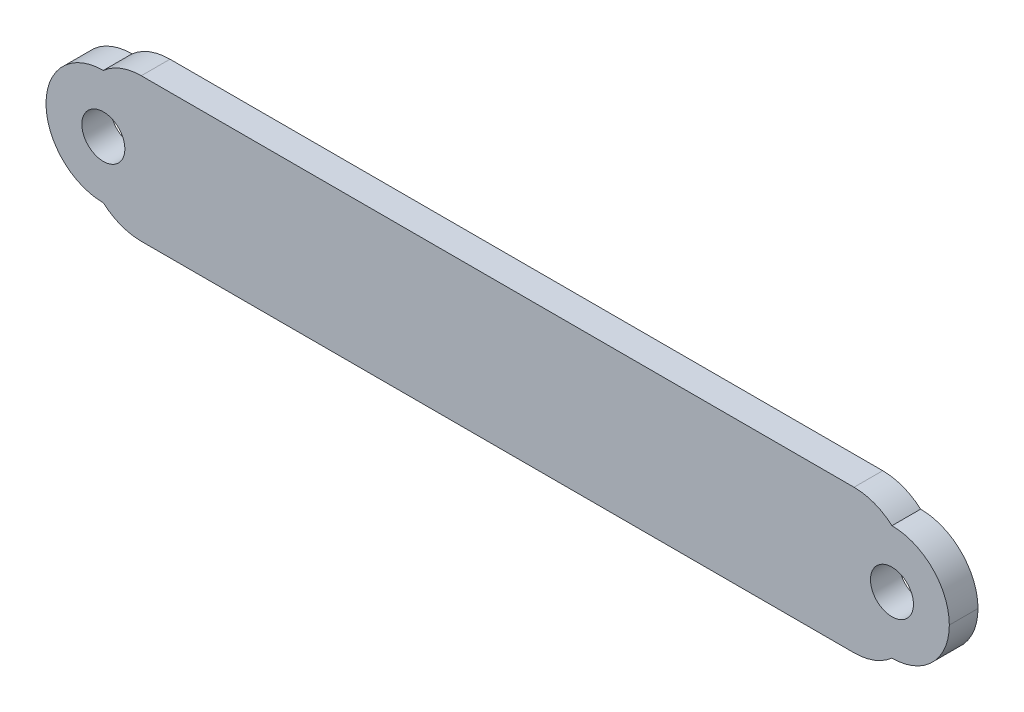
from build123d import *

# Parameters (mm, degrees)
SKETCH1_R           = 1.905
BOSS_EXTRUDE1_DEPTH = 2.54
FILLET7_R           = 5.08


with BuildPart() as part:
    # Sketch1 → Boss-Extrude1 (new body)
    with BuildSketch(Plane.XY):
        Polygon((5.08, 10.16), (6.35, 11.43), (40.005, 11.43), (40.005, -1.27), (6.35, -1.27), (5.08, 0), (0, 0), (0, 10.16), align=None)
        with Locations((5.08, 5.08)):
            Circle(SKETCH1_R, mode=Mode.SUBTRACT)
    extrude(amount=BOSS_EXTRUDE1_DEPTH)

    # Fillet7
    # the kernel refuses this fillet: 5.08 mm, written as the material it takes off along each edge
    with BuildSketch(Plane(origin=(6.35, -1.27, -5.225260413), x_dir=(1, 0, 0), z_dir=(0, 0, 1))) as fillet7_piece_1:
        with BuildLine():
            CenterArc((2.090104165, 5.08), FILLET7_R, 228.590377891, 41.409622109)
            Line((-1.27, 1.27), (-1.337202083, 1.1938))
            ThreePointArc((-1.337202083, 1.1938), (-0.706842049, 0.563157951), (-0.071842049, -0.071842049))
            Line((-0.071842049, -0.071842049), (0, -0.1016))
            Line((0, -0.1016), (2.090104165, -0.1016))
            Line((2.090104165, -0.1016), (2.090104165, 0))
        make_face()
    extrude(amount=12.990520825, mode=Mode.SUBTRACT)
    with BuildSketch(Plane(origin=(6.35, 11.43, -5.225260413), x_dir=(-0.7071067811865464, -0.7071067811865488, 0), z_dir=(0, 0, 1))) as fillet7_piece_2:
        with BuildLine():
            CenterArc((2.11417562, 5.070029277), FILLET7_R, 225, 41.409622109)
            Line((-1.477926828, 1.477926828), (-1.549768877, 1.40608478))
            Line((-1.549768877, 1.40608478), (-0.071842049, -0.071842049))
            Line((-0.071842049, -0.071842049), (0, -0.1016))
            ThreePointArc((0, -0.1016), (0.898025612, -0.1016), (1.789688736, -0.101400586))
            Line((1.789688736, -0.101400586), (1.796051224, 0))
        make_face()
    extrude(amount=12.990520825, mode=Mode.SUBTRACT)
    with BuildSketch(Plane(origin=(0, 0, -12.7), x_dir=(1, 0, 0), z_dir=(0, 0, 1)), Plane(origin=(0, 10.16, -12.7), x_dir=(0, -1, 0), z_dir=(0, 0, 1))) as fillet7_piece_3:
        with BuildLine():
            CenterArc((FILLET7_R, FILLET7_R), FILLET7_R, 180, 90)
            Line((0, FILLET7_R), (-FILLET7_R * 0.02, FILLET7_R))
            Line((-FILLET7_R * 0.02, FILLET7_R), (-FILLET7_R * 0.02, -FILLET7_R * 0.02))
            Line((-FILLET7_R * 0.02, -FILLET7_R * 0.02), (FILLET7_R, -FILLET7_R * 0.02))
            Line((FILLET7_R, -FILLET7_R * 0.02), (FILLET7_R, 0))
        make_face()
    extrude(amount=27.94, mode=Mode.SUBTRACT)

    # Mirror7: part across plane


with BuildPart() as part_1:
    add(part.part)
    add(part.part.mirror(Plane(origin=(40.005, -1.27, 2.54), x_dir=(0, 0, 1), z_dir=(-1, 0, 0))))


solid = part_1.part
